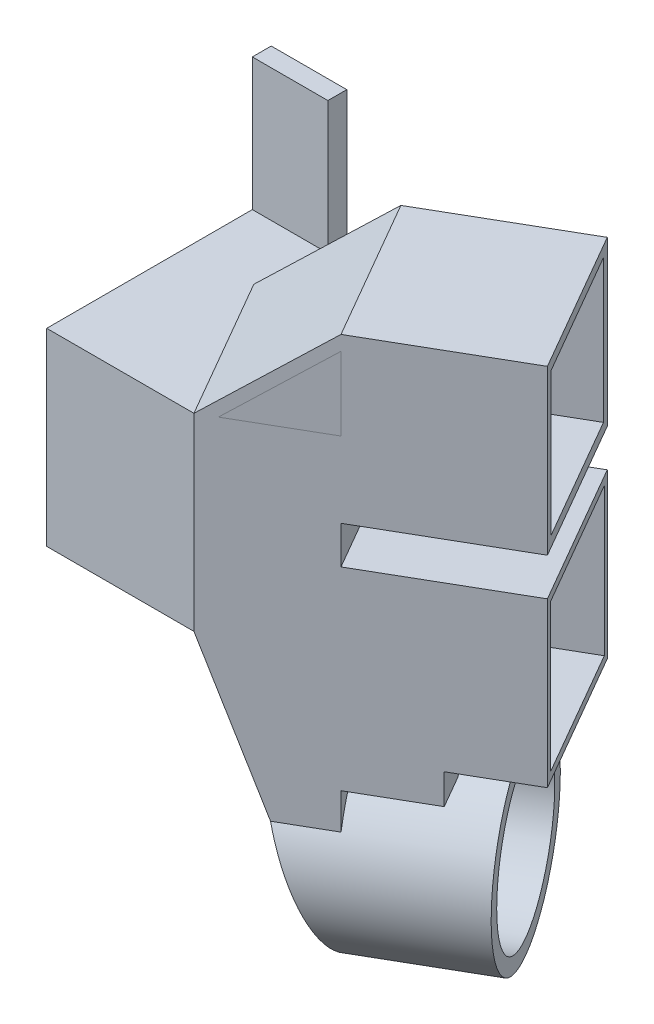
from build123d import *
from build123d.topology import SkipClean

# Parameters (mm, degrees)
SKETCH_1_W                         = 142
SKETCH_1_H                         = 50
EXTRUDE_1_DEPTH                    = 50
EXTRUDE_2_DEPTH                    = 50
SKETCH_3_W                         = 43.301270189
SKETCH_3_H                         = 43.301270189
SKETCH_3_W_2                       = 39
SKETCH_3_H_2                       = 39
EXTRUDE_1229_DEPTH                 = 40
SKETCH_4_W                         = 43.301270189
SKETCH_4_H                         = 43.301270189
SKETCH_4_W_2                       = 37.8
SKETCH_4_H_2                       = 37.8
EXTRUDE_1555_DEPTH                 = 40
SKETCH_6_R                         = 25
SKETCH_6_R_2                       = 21
EXTRUDE_5_DEPTH                    = 30
EXTRUDE_START                      = -12
SKETCH_8_R                         = 21
SKETCH_8_R_2                       = 5.5
EXTRUDE_6_DEPTH                    = 5
EXTRUDE_START_2                    = -43.30127
EXTRUDE_7_DEPTH                    = 43.30127
EXTRUDE_10_REACH                   = 275.562
SKETCH_10_W                        = 20
SKETCH_10_H                        = 8
EXTRUDE_11_REACH                   = 275.562
EXTRUDE_12_DEPTH                   = 2
EXTRUDE_13_DEPTH                   = 2
CUT_EXTRUDE_1_DEPTH                = 249.328501215
EXTRUDE_14_REACH                   = 225.182
CUT_EXTRUDE_2_REACH                = 278.049
SKETCH_17_W                        = 40
SKETCH_17_H                        = 40
CUT_EXTRUDE_START                  = -5
CUT_EXTRUDE_3_DEPTH                = 33.301270189
CUT_EXTRUDE_4_REACH                = 230.182
CUT_EXTRUDE_4_OFFSET_FROM_SURFACE  = 5
SKETCH_20_W                        = 27.8
SKETCH_20_H                        = 30
CUT_EXTRUDE_5_REACH                = 230.182
CUT_EXTRUDE_5_OFFSET_FROM_SURFACE  = 5
SKETCH_22_W                        = 29
SKETCH_22_H                        = 29
CUT_EXTRUDE_START_2                = -19.776530706
CUT_EXTRUDE_6_OUTLINE_R            = 5.5
CUT_EXTRUDE_6_DEPTH                = 1.776530706
CUT_EXTRUDE_START_3                = 177.616623489
CUT_EXTRUDE_6_2_OUTLINE_R          = 5.5
CUT_EXTRUDE_6_2_DEPTH              = 3.223469294
CUT_EXTRUDE_START_4                = 129
CUT_EXTRUDE_6_3_OUTLINE_W          = 14
CUT_EXTRUDE_6_3_OUTLINE_H          = 14
CUT_EXTRUDE_6_3_DEPTH              = 3.721874706
CUT_EXTRUDE_7_REACH                = 225.182
SKETCH_24_R                        = 21
EXTRUDE_START_3                    = -50
SKETCH_28_W                        = 40
SKETCH_28_H                        = 60
EXTRUDE_15_DEPTH                   = 25
SKETCH_28_H_2                      = 35
EXTRUDE_15_2_DEPTH                 = 25
EXTRUDE_16_REACH                   = 278.049
SKETCH_29_W                        = 25
SKETCH_29_H                        = 50
SKETCH_30_W                        = 25
SKETCH_30_H                        = 40
CUT_EXTRUDE_8_DEPTH                = 160
SKETCH_31_W                        = 15.570842249
SKETCH_31_H                        = 50
CUT_EXTRUDE_9_DEPTH                = 277.049207735
EXTRUDE_17_REACH                   = 278.049
SKETCH_32_W                        = 5
SKETCH_32_H                        = 40
SKETCH_33_W                        = 40
SKETCH_33_H                        = 30
CUT_EXTRUDE_10_DEPTH               = 5
SKETCH_34_W                        = 40
SKETCH_34_H                        = 34.429157751
CUT_EXTRUDE_12_DEPTH               = 5
CUT_EXTRUDE_15_REACH               = 280.632
CUT_EXTRUDE_15_OFFSET_FROM_SURFACE = 5
SKETCH_37_W                        = 15.381197846
SKETCH_37_H                        = 25
EXTRUDE_18_DEPTH                   = 20
CHAMFER_1_SIZE                     = 1
CUT_EXTRUDE_16_DEPTH               = 277.049207735
CUT_EXTRUDE_16_DEPTH_BACK          = 277.049207735
SKETCH_38_W                        = 168.693453403
SKETCH_38_H                        = 59.429157751
SKETCH_39_W                        = 20
SKETCH_39_H                        = 5
EXTRUDE_19_DEPTH                   = 35
SKETCH_40_W                        = 20
SKETCH_40_H                        = 4
EXTRUDE_20_DEPTH                   = 35
CUT_EXTRUDE_17_DEPTH               = 65
SKETCH_42_W                        = 3
SKETCH_42_H                        = 40
EXTRUDE_21_DEPTH                   = 10


with BuildPart() as part:
    # 草图1 → 凸台-拉伸1 (new body)
    with BuildSketch(Plane.XY):
        with Locations((71, -25)):
            Rectangle(SKETCH_1_W, SKETCH_1_H)
    extrude(amount=-EXTRUDE_1_DEPTH)

    # 草图2 → 凸台-拉伸2 (add)
    with BuildSketch(Plane(origin=(0, 0, 0), x_dir=(1, 0, 0), z_dir=(0, 1, 0))):
        Polygon((172, 67.320508076), (142, 50), (142, 0), (193.650635095, 29.820508076), align=None)
    extrude(amount=-EXTRUDE_2_DEPTH)

    # 草图3 → Extrude 1229 (add)
    with BuildSketch(Plane(origin=(158.150635095, 0, -91.308311744), x_dir=(-0.5000000000000012, 0, -0.866025403784438), z_dir=(0.8660254037844379, 0, -0.5000000000000011))):
        with Locations((-49.349364906, -51.650635095)):
            Rectangle(SKETCH_3_W, SKETCH_3_H)
        with Locations((-49.349364905, -51.650635095)):
            Rectangle(SKETCH_3_W_2, SKETCH_3_H_2, mode=Mode.SUBTRACT)
    extrude(amount=EXTRUDE_1229_DEPTH)

    # 草图4 → Extrude 1555 (add)
    with BuildSketch(Plane(origin=(158.150635095, 0, -91.308311744), x_dir=(-0.5000000000000012, 0, -0.866025403784438), z_dir=(0.8660254037844379, 0, -0.5000000000000011))):
        with Locations((-49.349364906, 1.650635095)):
            Rectangle(SKETCH_4_W, SKETCH_4_H)
        with Locations((-49.349364905, 1.650635095)):
            Rectangle(SKETCH_4_W_2, SKETCH_4_H_2, mode=Mode.SUBTRACT)
    extrude(amount=EXTRUDE_1555_DEPTH)



with BuildPart() as body_2:
    # 草图6 → 凸台-拉伸5 (new body)
    with BuildSketch(Plane(origin=(158.150635095, 0, -91.308311744), x_dir=(-0.5000000000000012, 0, -0.866025403784438), z_dir=(0.8660254037844379, 0, -0.5000000000000011))):
        with Locations(Location((-49.349364905, -103.301270189, 0), (0, 0, 180))):
            Circle(SKETCH_6_R)
        with Locations(Location((-49.349364905, -103.301270189, 0), (0, 0, 180))):
            Circle(SKETCH_6_R_2, mode=Mode.SUBTRACT)
    extrude(amount=EXTRUDE_5_DEPTH)

    # 草图8 → 凸台-拉伸6 (add)
    with BuildSketch(Plane(origin=(184.131397208, 0, -106.308311744), x_dir=(-0.5000000000000014, 0, -0.8660254037844379), z_dir=(0.8660254037844378, 0, -0.5000000000000013)).offset(EXTRUDE_START)):
        with Locations(Location((-49.349364905, -103.301270189, 0), (0, 0, 180))):
            Circle(SKETCH_8_R)
        with Locations((-49.349364905, -103.301270189)):
            Circle(SKETCH_8_R_2, mode=Mode.SUBTRACT)
    extrude(amount=-EXTRUDE_6_DEPTH)


with BuildPart() as part_1:
    with SkipClean():  # the faces are left unmerged after this step: merging them gives an invalid solid
        add(part.part)

        add(body_2.part)  # 凸台-拉伸7 merges body 2
        # 草图9 → 凸台-拉伸7 (add)
        with BuildSketch(Plane(origin=(13.849364905, 0, 23.987803669), x_dir=(-0.866025403784438, 0, 0.5000000000000012), z_dir=(-0.5000000000000012, 0, -0.866025403784438)).offset(EXTRUDE_START_2)):
            Polygon((-154.117291835, -50), (-182.616623489, -128.301270189), (-182.616623489, -50), align=None)
        extrude(amount=EXTRUDE_7_DEPTH)

    # 凸台-拉伸10: up to this face of the body (flat: up to its plane)
    extrude_10_end = Plane(part_1.part.faces().sort_by_distance((191.011477977, -25, -28.296790003))[0])
    # 草图10 → 凸台-拉伸10 (add, up to the picked face)
    with BuildSketch(Plane(origin=(13.849364905, 0, 23.987803669), x_dir=(-0.866025403784438, 0, 0.5000000000000012), z_dir=(-0.5000000000000012, 0, -0.866025403784438)), mode=Mode.PRIVATE) as extrude_10_sk1:
        with Locations((-192.616623489, -77.301270189)):
            Rectangle(SKETCH_10_W, SKETCH_10_H)
    extrude_10_tool1 = split(extrude(extrude_10_sk1.sketch, amount=-EXTRUDE_10_REACH, mode=Mode.PRIVATE), bisect_by=extrude_10_end, keep=Keep.BOTH, mode=Mode.PRIVATE)
    add(extrude_10_tool1.solids().sort_by(Axis((180.660254, -77.30127, -72.320508), (0.5000000000000012, 0, 0.866025403784438)))[0])

    # 凸台-拉伸11: up to this face of the body (flat: up to its plane)
    extrude_11_end = Plane(part_1.part.faces().sort_by_distance((191.011477977, -25, -28.296790003))[0])
    # 草图11 → 凸台-拉伸11 (add, up to the picked face)
    with BuildSketch(Plane(origin=(13.849364905, 0, 23.987803669), x_dir=(-0.866025403784438, 0, 0.5000000000000012), z_dir=(-0.5000000000000012, 0, -0.866025403784438)), mode=Mode.PRIVATE) as extrude_11_sk1:
        Polygon((-154.117291835, 0), (-182.616623489, 23.301270189), (-182.616623489, 19.42617797), (-158.856841973, 0), align=None)
    extrude_11_tool1 = split(extrude(extrude_11_sk1.sketch, amount=-EXTRUDE_11_REACH, mode=Mode.PRIVATE), bisect_by=extrude_11_end, keep=Keep.BOTH, mode=Mode.PRIVATE)
    add(extrude_11_tool1.solids().sort_by(Axis((160.654549, 10.711149, -60.770209), (0.5000000000000012, 0, 0.866025403784438)))[0])

    # 草图12 → 凸台-拉伸12 (add)
    with SkipClean():  # the faces are left unmerged after this step: merging them gives an invalid solid
        with BuildSketch(Plane(origin=(13.849364905, 0, 23.987803669), x_dir=(-0.866025403784438, 0, 0.5000000000000012), z_dir=(-0.5000000000000012, 0, -0.866025403784438))):
            Polygon((-182.616623489, 19.42617797), (-182.616623489, 0), (-158.856841973, 0), align=None)
        extrude(amount=-EXTRUDE_12_DEPTH)

    # 草图15 → 切除-拉伸1 (cut, through all)
    with SkipClean():  # the faces are left unmerged after this step: merging them gives an invalid solid
        with BuildSketch(Plane(origin=(184.131397208, 0, -106.308311744), x_dir=(-0.5000000000000014, 0, -0.8660254037844379), z_dir=(0.8660254037844378, 0, -0.5000000000000013))):
            with BuildLine():
                Line((-49.349364905, -128.301270189), (-27.698729811, -128.301270189))
                Line((-27.698729811, -128.301270189), (-27.698729811, -115.801270189))
                ThreePointArc((-27.698729811, -115.801270189), (-36.849364905, -124.951905284), (-49.349364905, -128.301270189))
            make_face()
            with BuildLine():
                Line((-71, -128.301270189), (-49.349364905, -128.301270189))
                ThreePointArc((-49.349364905, -128.301270189), (-61.849364905, -124.951905284), (-71, -115.801270189))
                Line((-71, -115.801270189), (-71, -128.301270189))
            make_face()
        extrude(amount=-CUT_EXTRUDE_1_DEPTH, mode=Mode.SUBTRACT)

    # 凸台-拉伸14: up to this plane
    with SkipClean():  # the faces are left unmerged after this step: merging them gives an invalid solid
        extrude_14_end = Plane(origin=(210.632725537, -50, 56.591998698), z_dir=(-0.8137976813493748, -0.3420201433256631, 0.46984631039295627))
        # 草图16 → 凸台-拉伸14 (add, up to the surface)
        with BuildSketch(Plane(origin=(158.150635095, 0, -91.308311744), x_dir=(0.5000000000000014, 0, 0.8660254037844379), z_dir=(-0.8660254037844378, 0, 0.5000000000000013)), mode=Mode.PRIVATE) as extrude_14_sk1:
            with BuildLine():
                Line((27.698729811, -115.801270189), (27.698729811, -90.801270189))
                ThreePointArc((27.698729811, -90.801270189), (24.349364905, -103.301270189), (27.698729811, -115.801270189))
            make_face()
        extrude_14_tool1 = split(extrude(extrude_14_sk1.sketch, amount=EXTRUDE_14_REACH, mode=Mode.PRIVATE), bisect_by=extrude_14_end, keep=Keep.BOTH, mode=Mode.PRIVATE)
        add(extrude_14_tool1.solids().sort_by_distance((171.326125, -103.30127, -68.487693))[0])
        # 草图16 → 凸台-拉伸14 (add, up to the surface)
        with BuildSketch(Plane(origin=(158.150635095, 0, -91.308311744), x_dir=(0.5000000000000014, 0, 0.8660254037844379), z_dir=(-0.8660254037844378, 0, 0.5000000000000013)), mode=Mode.PRIVATE) as extrude_14_sk2:
            with BuildLine():
                Line((71, -90.801270189), (71, -115.801270189))
                ThreePointArc((71, -115.801270189), (74.349364905, -103.301270189), (71, -90.801270189))
            make_face()
        extrude_14_tool2 = split(extrude(extrude_14_sk2.sketch, amount=EXTRUDE_14_REACH, mode=Mode.PRIVATE), bisect_by=extrude_14_end, keep=Keep.BOTH, mode=Mode.PRIVATE)
        add(extrude_14_tool2.solids().sort_by_distance((194.32451, -103.30127, -28.653323))[0])
    add(part_1.part.scale(1), mode=Mode.REPLACE)  # the faces are merged on a copy

    # 切除-拉伸2: up to this plane
    cut_extrude_2_end = Plane(origin=(25.5, -134.851864524, 44.167295593), z_dir=(0.5000000000000016, 0, 0.8660254037844378))
    # 草图17 → 切除-拉伸2 (cut, up to the surface)
    with BuildSketch(Plane.ZY, mode=Mode.PRIVATE) as cut_extrude_2_sk1:
        with Locations((-25, -25)):
            Rectangle(SKETCH_17_W, SKETCH_17_H)
    cut_extrude_2_tool1 = split(extrude(cut_extrude_2_sk1.sketch, amount=-CUT_EXTRUDE_2_REACH, mode=Mode.PRIVATE), bisect_by=cut_extrude_2_end, keep=Keep.BOTH, mode=Mode.PRIVATE)
    add(cut_extrude_2_tool1.solids().sort_by_distance((0, -25, -25))[0], mode=Mode.SUBTRACT)

    # 草图19 → 切除-拉伸3 (cut)
    with BuildSketch(Plane(origin=(13.849364905, 0, 23.987803669), x_dir=(-0.866025403784438, 0, 0.5000000000000012), z_dir=(-0.5000000000000012, 0, -0.866025403784438)).offset(CUT_EXTRUDE_START)):
        Polygon((-177.616623489, -5), (-177.616623489, -99.944861091), (-157.618329526, -45), (-152.975607337, -45), (-152.975607337, -5), align=None)
    extrude(amount=-CUT_EXTRUDE_3_DEPTH, mode=Mode.SUBTRACT)

    # 切除-拉伸4: up to this face of the body (flat: up to its plane, moved by the offset)
    cut_extrude_4_end = Plane(part_1.part.faces().sort_by_distance((173.037030357, 9.713088985, -41.764537293))[0]).offset(CUT_EXTRUDE_4_OFFSET_FROM_SURFACE)
    # 草图20 → 切除-拉伸4 (cut, up to the picked face)
    with BuildSketch(Plane(origin=(158.150635095, 0, -91.308311744), x_dir=(-0.5000000000000012, 0, -0.866025403784438), z_dir=(0.8660254037844379, 0, -0.5000000000000011)), mode=Mode.PRIVATE) as cut_extrude_4_sk1:
        with Locations((-49.349364905, -2.249364905)):
            Rectangle(SKETCH_20_W, SKETCH_20_H)
    cut_extrude_4_tool1 = split(extrude(cut_extrude_4_sk1.sketch, amount=-CUT_EXTRUDE_4_REACH, mode=Mode.PRIVATE), bisect_by=cut_extrude_4_end, keep=Keep.BOTH, mode=Mode.PRIVATE)
    add(cut_extrude_4_tool1.solids().sort_by(Axis((182.825318, -2.249365, -48.570508), (-0.8660254037844379, 0, 0.5000000000000011)))[0], mode=Mode.SUBTRACT)

    # 切除-拉伸5: up to this face of the body (flat: up to its plane, moved by the offset)
    cut_extrude_5_end = Plane(part_1.part.faces().sort_by_distance((169.937789639, -87.415411915, -41.129890369))[0]).offset(-CUT_EXTRUDE_5_OFFSET_FROM_SURFACE)
    # 草图22 → 切除-拉伸5 (cut, up to the picked face)
    with BuildSketch(Plane(origin=(158.150635095, 0, -91.308311744), x_dir=(-0.5000000000000012, 0, -0.866025403784438), z_dir=(0.8660254037844379, 0, -0.5000000000000011)), mode=Mode.PRIVATE) as cut_extrude_5_sk1:
        with Locations((-49.349364905, -51.650635095)):
            Rectangle(SKETCH_22_W, SKETCH_22_H)
    cut_extrude_5_tool1 = split(extrude(cut_extrude_5_sk1.sketch, amount=-CUT_EXTRUDE_5_REACH, mode=Mode.PRIVATE), bisect_by=cut_extrude_5_end, keep=Keep.BOTH, mode=Mode.PRIVATE)
    add(cut_extrude_5_tool1.solids().sort_by(Axis((182.825318, -51.650635, -48.570508), (-0.8660254037844379, 0, 0.5000000000000011)))[0], mode=Mode.SUBTRACT)

    # 切除-拉伸6: read off the stored shape, not the designer's step
    # 切除-拉伸6 outline → 切除-拉伸6 (cut)
    with BuildSketch(Plane(origin=(173.739092363, 0, -100.308311744), x_dir=(-0.5000000000000017, 0, -0.8660254037844378), z_dir=(0.8660254037844377, 0, -0.5000000000000016)).offset(CUT_EXTRUDE_START_2)):
        with Locations((-49.349364905, -103.301270189)):
            Circle(CUT_EXTRUDE_6_OUTLINE_R)
    extrude(amount=CUT_EXTRUDE_6_DEPTH, mode=Mode.SUBTRACT)

    # Cut-Extrude 6 2 outline → Cut-Extrude 6 2 (cut)
    with BuildSketch(Plane(origin=(0, 0, 0), x_dir=(0.5000000000000016, 0, 0.8660254037844377), z_dir=(0.8660254037844377, 0, -0.5000000000000018)).offset(CUT_EXTRUDE_START_3)):
        with Locations((49.349364905, 103.301270189)):
            Circle(CUT_EXTRUDE_6_2_OUTLINE_R)
    extrude(amount=CUT_EXTRUDE_6_2_DEPTH, mode=Mode.SUBTRACT)

    # Cut-Extrude 6 3 outline → Cut-Extrude 6 3 (add)
    with SkipClean():  # the faces are left unmerged after this step: merging them gives an invalid solid
        with BuildSketch(Plane(origin=(0, 0, 0), x_dir=(0.5811482890195767, -0.4789400655085298, 0.6579385076284131), z_dir=(0.8137976813493747, 0.342020143325664, -0.46984631039295593)).offset(CUT_EXTRUDE_START_4)):
            with Locations((123, 111)):
                Rectangle(CUT_EXTRUDE_6_3_OUTLINE_W, CUT_EXTRUDE_6_3_OUTLINE_H)
        extrude(amount=CUT_EXTRUDE_6_3_DEPTH)

    # 切除-拉伸7: up to this face of the body (flat: up to its plane)
    cut_extrude_7_end = Plane(part_1.part.faces().sort_by_distance((172.347083394, -80.42193919, -42.507817086))[0])
    # 草图24 → 切除-拉伸7 (cut, up to the picked face)
    with BuildSketch(Plane(origin=(158.150635095, 0, -91.308311744), x_dir=(-0.5000000000000013, 0, -0.8660254037844379), z_dir=(0.8660254037844378, 0, -0.5000000000000012)), mode=Mode.PRIVATE) as cut_extrude_7_sk1:
        with Locations(Location((-49.349364905, -103.301270189, 0), (0, 0, 209.625730133))):
            Circle(SKETCH_24_R)
    cut_extrude_7_tool1 = split(extrude(cut_extrude_7_sk1.sketch, amount=-CUT_EXTRUDE_7_REACH, mode=Mode.PRIVATE), bisect_by=cut_extrude_7_end, keep=Keep.BOTH, mode=Mode.PRIVATE)
    add(cut_extrude_7_tool1.solids().sort_by(Axis((182.825318, -103.30127, -48.570508), (-0.8660254037844378, 0, 0.5000000000000012)))[0], mode=Mode.SUBTRACT)

    # 凸台-拉伸16: up to this plane
    with SkipClean():  # the faces are left unmerged after this step: merging them gives an invalid solid
        extrude_16_end = Plane(origin=(13.849364905, -134.851864524, 23.987803669), z_dir=(0.5000000000000013, 0, 0.8660254037844379))
        # 草图29 → 凸台-拉伸16 (add, up to the surface)
        with BuildSketch(Plane.ZY, mode=Mode.PRIVATE) as extrude_16_sk1:
            with Locations((-62.5, -25)):
                Rectangle(SKETCH_29_W, SKETCH_29_H)
        extrude_16_tool1 = split(extrude(extrude_16_sk1.sketch, amount=-EXTRUDE_16_REACH, mode=Mode.PRIVATE), bisect_by=extrude_16_end, keep=Keep.BOTH, mode=Mode.PRIVATE)
        add(extrude_16_tool1.solids().sort_by_distance((0, -25, -62.5))[0])

    # 草图30 → 切除-拉伸8 (cut)
    with SkipClean():  # the faces are left unmerged after this step: merging them gives an invalid solid
        with BuildSketch(Plane.ZY):
            with Locations((-57.5, -25)):
                Rectangle(SKETCH_30_W, SKETCH_30_H)
        extrude(amount=-CUT_EXTRUDE_8_DEPTH, mode=Mode.SUBTRACT)

    # 草图31 → 切除-拉伸9 (cut, through all)
    with SkipClean():  # the faces are left unmerged after this step: merging them gives an invalid solid
        with BuildSketch(Plane.ZY):
            with Locations((-7.785421125, -25)):
                Rectangle(SKETCH_31_W, SKETCH_31_H)
        extrude(amount=-CUT_EXTRUDE_9_DEPTH, mode=Mode.SUBTRACT)

    # 凸台-拉伸17: up to this plane
    extrude_17_end = Plane(origin=(25.5, -134.851864524, 44.167295593), z_dir=(0.5000000000000016, 0, 0.8660254037844378))
    # 草图32 → 凸台-拉伸17 (add, up to the surface)
    with BuildSketch(Plane.ZY, mode=Mode.PRIVATE) as extrude_17_sk1:
        with Locations((-18.070842249, -25)):
            Rectangle(SKETCH_32_W, SKETCH_32_H)
    extrude_17_tool1 = split(extrude(extrude_17_sk1.sketch, amount=-EXTRUDE_17_REACH, mode=Mode.PRIVATE), bisect_by=extrude_17_end, keep=Keep.BOTH, mode=Mode.PRIVATE)
    add(extrude_17_tool1.solids().sort_by_distance((0, -25, -18.070842))[0])

    # 草图33 → 切除-拉伸10 (cut)
    with BuildSketch(Plane.XY.offset(-15.570842249)):
        with Locations((20, -25)):
            Rectangle(SKETCH_33_W, SKETCH_33_H)
    extrude(amount=-CUT_EXTRUDE_10_DEPTH, mode=Mode.SUBTRACT)

    # 草图34 → 切除-拉伸12 (cut)
    with BuildSketch(Plane(origin=(0, 0, 0), x_dir=(1, 0, 0), z_dir=(0, 1, 0))):
        with Locations((110, 37.785421125)):
            Rectangle(SKETCH_34_W, SKETCH_34_H)
    extrude(amount=-CUT_EXTRUDE_12_DEPTH, mode=Mode.SUBTRACT)

    # 切除-拉伸15: up to this face of the body (flat: up to its plane, moved by the offset)
    cut_extrude_15_end = Plane(part_1.part.faces().sort_by_distance((77.969126343, -25, -15.570842249))[0]).offset(-CUT_EXTRUDE_15_OFFSET_FROM_SURFACE)
    # 草图35 → 切除-拉伸15 (cut, up to the picked face)
    with BuildSketch(Plane(origin=(25.5, 0, 44.167295593), x_dir=(-0.8660254037844378, 0, 0.5000000000000016), z_dir=(-0.5000000000000016, 0, -0.8660254037844378)), mode=Mode.PRIVATE) as cut_extrude_15_sk1:
        Polygon((-152.975607337, -11.267029174), (-152.975607337, -17.249364905), (-152.975607337, -45), (-129.476275683, -45), (-129.476275683, -5), (-152.975607337, -5), align=None)
    cut_extrude_15_tool1 = split(extrude(cut_extrude_15_sk1.sketch, amount=-CUT_EXTRUDE_15_REACH, mode=Mode.PRIVATE), bisect_by=cut_extrude_15_end, keep=Keep.BOTH, mode=Mode.PRIVATE)
    add(cut_extrude_15_tool1.solids().sort_by(Axis((147.805253, -25, -26.445675), (0.5000000000000016, 0, 0.8660254037844378)))[0], mode=Mode.SUBTRACT)



with BuildPart() as body_2_2:
    # 草图14 → 凸台-拉伸13 (new body)
    with BuildSketch(Plane(origin=(35.5, 0, 61.487803669), x_dir=(0.8660254037844377, 0, -0.5000000000000018), z_dir=(0.5000000000000018, 0, 0.8660254037844377))):
        Polygon((182.616623489, 19.42617797), (158.856841973, 0), (182.616623489, 0), align=None)
    extrude(amount=-EXTRUDE_13_DEPTH)


with BuildPart() as body_3:
    # 草图28 → 凸台-拉伸15 (new body)
    with BuildSketch(Plane.XY.offset(EXTRUDE_START_3)):
        with Locations((20, 30)):
            Rectangle(SKETCH_28_W, SKETCH_28_H)
    extrude(amount=-EXTRUDE_15_DEPTH)


with BuildPart() as body_4:
    # 草图28 → Extrude 15 2 (new body)
    with BuildSketch(Plane.XY.offset(EXTRUDE_START_3)):
        with Locations((20, -67.5)):
            Rectangle(SKETCH_28_W, SKETCH_28_H_2)
    extrude(amount=-EXTRUDE_15_2_DEPTH)


with BuildPart() as part_2:
    with SkipClean():  # the faces are left unmerged after this step: merging them gives an invalid solid
        add(part_1.part)

        add(body_3.part)  # 凸台-拉伸18 merges body 3

        add(body_4.part)  # 凸台-拉伸18 merges body 4
        # 草图37 → 凸台-拉伸18 (add)
        with BuildSketch(Plane.ZY):
            with Locations((-62.309401077, 12.5)):
                Rectangle(SKETCH_37_W, SKETCH_37_H)
            with Locations((-62.309401077, -62.5)):
                Rectangle(SKETCH_37_W, SKETCH_37_H)
        extrude(amount=EXTRUDE_18_DEPTH)

    # 倒角1
    chamfer_1_edges = [part_2.edges().sort_by_distance(p)[0] for p in [
        (-20, -62.5, -70),
        (-20, -75, -62.309401077),
        (-20, -62.5, -54.618802154),
        (-20, -50, -62.309401077),
        (-20, 12.5, -70),
        (-20, 0, -62.309401077),
        (-20, 12.5, -54.618802154),
        (-20, 25, -62.309401077),
    ]]
    chamfer(chamfer_1_edges, length=CHAMFER_1_SIZE)

    # 草图38 → 切除-拉伸16 (cut, two sides: drawn at the far end of the back side and taken through both)
    with SkipClean():  # the faces are left unmerged after this step: merging them gives an invalid solid
        with BuildSketch(Plane(origin=(0, 0, 0), x_dir=(1, 0, 0), z_dir=(0, 1, 0)).offset(-CUT_EXTRUDE_16_DEPTH_BACK)):
            with Locations((45.653273298, 45.285421125)):
                Rectangle(SKETCH_38_W, SKETCH_38_H)
        extrude(amount=CUT_EXTRUDE_16_DEPTH + CUT_EXTRUDE_16_DEPTH_BACK, mode=Mode.SUBTRACT)

    # 草图39 → 凸台-拉伸19 (add)
    with SkipClean():  # the faces are left unmerged after this step: merging them gives an invalid solid
        with BuildSketch(Plane(origin=(0, 0, 0), x_dir=(1, 0, 0), z_dir=(0, 1, 0))):
            with Locations((140, 72.5)):
                Rectangle(SKETCH_39_W, SKETCH_39_H)
        extrude(amount=EXTRUDE_19_DEPTH)

    # 草图40 → 凸台-拉伸20 (add)
    with SkipClean():  # the faces are left unmerged after this step: merging them gives an invalid solid
        with BuildSketch(Plane.XZ.offset(50)):
            with Locations((140, -73)):
                Rectangle(SKETCH_40_W, SKETCH_40_H)
        extrude(amount=EXTRUDE_20_DEPTH)

    # 草图41 → 切除-拉伸17 (cut)
    with SkipClean():  # the faces are left unmerged after this step: merging them gives an invalid solid
        with BuildSketch(Plane(origin=(0, 0, 0), x_dir=(1, 0, 0), z_dir=(0, 1, 0))):
            Polygon((185.301270189, 75), (160, 75), (160, 60.392304845), align=None)
        extrude(amount=-CUT_EXTRUDE_17_DEPTH, mode=Mode.SUBTRACT)

    # 草图42 → 凸台-拉伸21 (add)
    with SkipClean():  # the faces are left unmerged after this step: merging them gives an invalid solid
        with BuildSketch(Plane.XY.offset(-70)):
            with Locations((158.5, -25)):
                Rectangle(SKETCH_42_W, SKETCH_42_H)
        extrude(amount=EXTRUDE_21_DEPTH)


solid = Compound([body_2_2.part, part_2.part])
